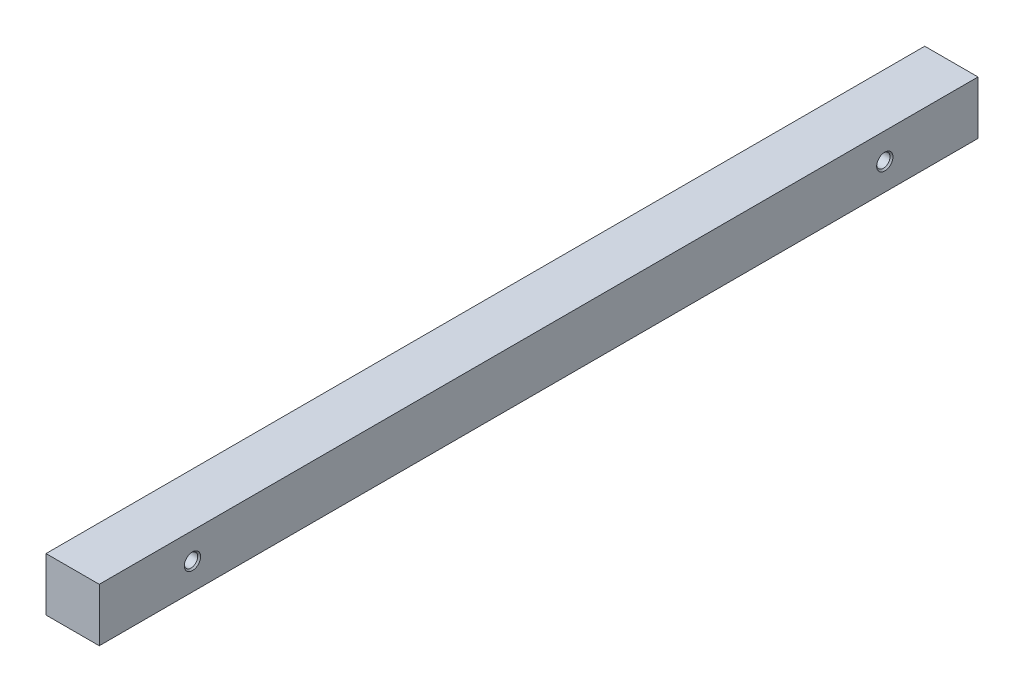
from build123d import *

# Parameters (mm, degrees)
ESQUISSE1_W                     = 10
ESQUISSE1_H                     = 10
BOSS_EXTRU_1_DEPTH              = 82.5
TROU_TARAUD_M3X0_51_D           = 2.5
TROU_TARAUD_M3X0_51_CSINK_D     = 3.05
TROU_TARAUD_M3X0_51_CSINK_ANGLE = 90


with BuildPart() as part:
    # Esquisse1 → Boss.-Extru.1 (new, symmetric)
    with BuildSketch(Plane.XY):
        Rectangle(ESQUISSE1_W, ESQUISSE1_H)
    extrude(amount=BOSS_EXTRU_1_DEPTH, both=True)

    # Trou taraudé M3x0.51 (through all)
    with Locations(Plane(origin=(5, 0, 0), x_dir=(0, 0, -1), z_dir=(1, 0, 0))):
        with Locations((65, 0), (-65, 0)):
            CounterSinkHole(TROU_TARAUD_M3X0_51_D / 2, TROU_TARAUD_M3X0_51_CSINK_D / 2, counter_sink_angle=TROU_TARAUD_M3X0_51_CSINK_ANGLE)


solid = part.part
